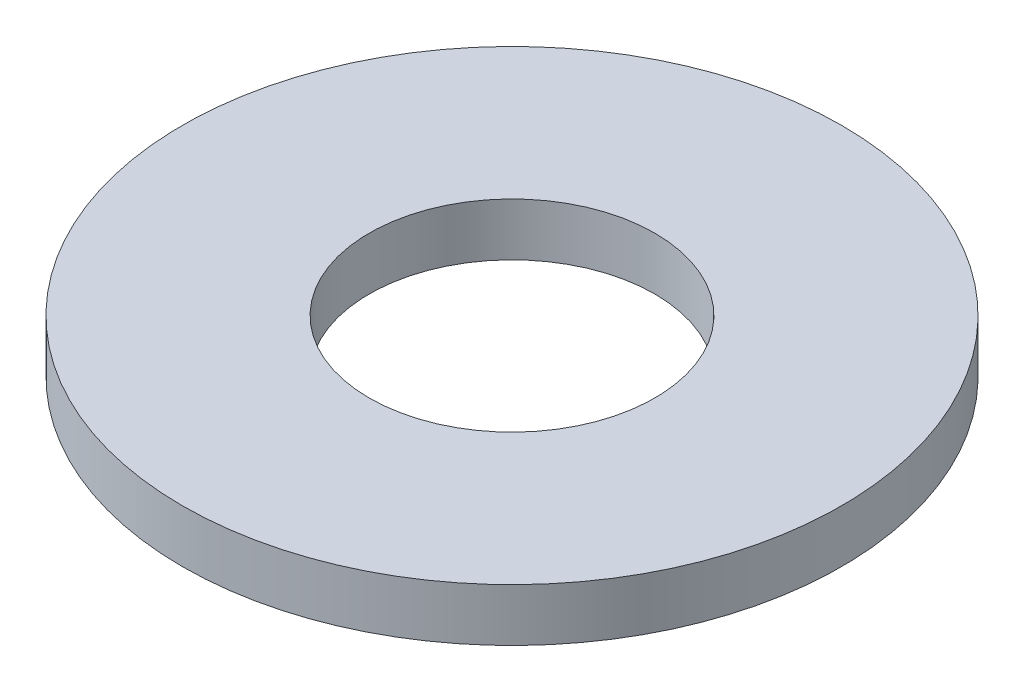
from build123d import *

# Parameters (mm, degrees)
SKETCH1_R           = 75
BOSS_EXTRUDE1_DEPTH = 12
SKETCH2_R           = 32.5
CUT_EXTRUDE1_DEPTH  = 107.742681248


with BuildPart() as part:
    # Sketch1 → Boss-Extrude1 (new body)
    with BuildSketch(Plane(origin=(0, 0, 0), x_dir=(1, 0, 0), z_dir=(0, 1, 0))):
        Circle(SKETCH1_R)
    extrude(amount=BOSS_EXTRUDE1_DEPTH)

    # Sketch2 → Cut-Extrude1 (cut, through all)
    with BuildSketch(Plane(origin=(0, 0, 0), x_dir=(1, 0, 0), z_dir=(0, 1, 0))):
        Circle(SKETCH2_R)
    extrude(amount=CUT_EXTRUDE1_DEPTH, mode=Mode.SUBTRACT)


solid = part.part
